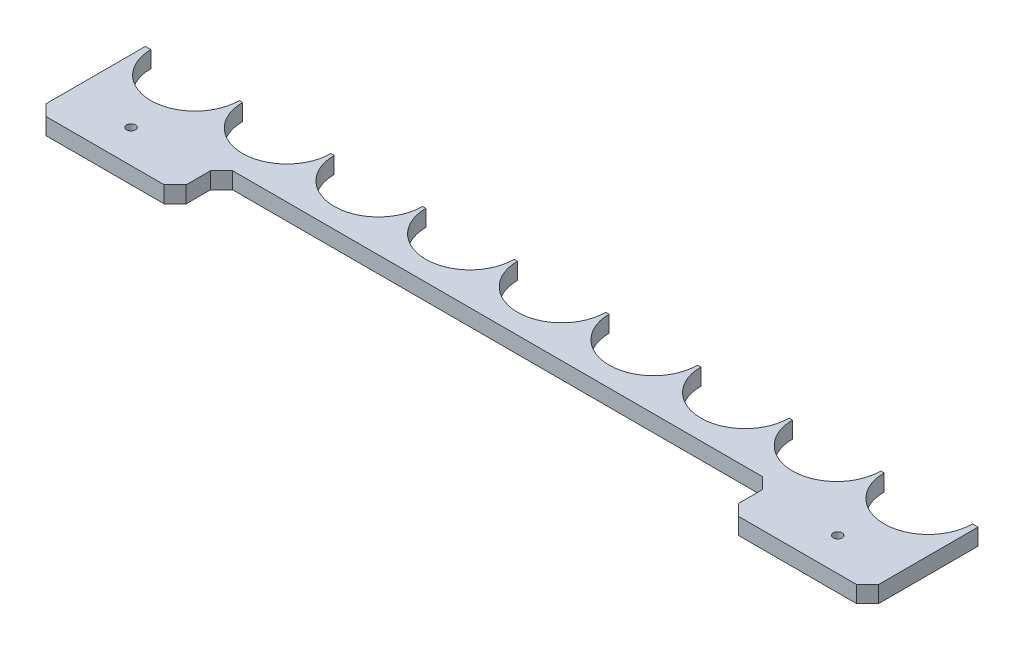
from build123d import *

# Parameters (mm, degrees)
SKETCH1_R          = 4
BASE_FLANGE1_DEPTH = 15
SKETCH6_W          = 500
SKETCH6_H          = 42
CUT_EXTRUDE1_DEPTH = 381.59689962
CHAMFER1_SIZE      = 10


# Sheet-metal steps are written as plain solids
with BuildPart() as part:
    # Sketch1 → Base-Flange1 (new body)
    with BuildSketch(Plane(origin=(0, 0, 0), x_dir=(1, 0, 0), z_dir=(0, 1, 0))):
        with BuildLine():
            Line((372, 50), (377, 50))
            Line((377, 50), (377, -50))
            Line((377, -50), (-377, -50))
            Line((-377, -50), (-377, 50))
            Line((-377, 50), (-372, 50))
            ThreePointArc((-372, 50), (-332, 10), (-292, 50))
            Line((-292, 50), (-289, 50))
            ThreePointArc((-289, 50), (-249, 10), (-209, 50))
            Line((-209, 50), (-206, 50))
            ThreePointArc((-206, 50), (-166, 10), (-126, 50))
            Line((-126, 50), (-123, 50))
            ThreePointArc((-123, 50), (-83, 10), (-43, 50))
            Line((-43, 50), (-40, 50))
            ThreePointArc((-40, 50), (0, 10), (40, 50))
            Line((40, 50), (43, 50))
            ThreePointArc((43, 50), (83, 10), (123, 50))
            Line((123, 50), (126, 50))
            ThreePointArc((126, 50), (166, 10), (206, 50))
            Line((206, 50), (209, 50))
            ThreePointArc((209, 50), (249, 10), (289, 50))
            Line((289, 50), (292, 50))
            ThreePointArc((292, 50), (332, 10), (372, 50))
        make_face()
        with Locations(Location((-320, -20, 0), (0, 0, 270))):
            Circle(SKETCH1_R, mode=Mode.SUBTRACT)
        with Locations(Location((320, -20, 0), (0, 0, 90))):
            Circle(SKETCH1_R, mode=Mode.SUBTRACT)
    extrude(amount=-BASE_FLANGE1_DEPTH)

    # Sketch6 → Cut-Extrude1 (cut, through all)
    with BuildSketch(Plane(origin=(0, 0, 0), x_dir=(1, 0, 0), z_dir=(0, 1, 0))):
        with Locations((0, -29)):
            Rectangle(SKETCH6_W, SKETCH6_H)
    extrude(amount=-CUT_EXTRUDE1_DEPTH, mode=Mode.SUBTRACT)

    # Chamfer1
    chamfer1_edges = [part.edges().sort_by_distance(p)[0] for p in [
        (377, -7.5, 50),
        (-377, -7.5, 50),
        (-250, -7.5, 50),
        (-250, -7.5, 8),
        (250, -7.5, 8),
        (250, -7.5, 50),
    ]]
    chamfer(chamfer1_edges, length=CHAMFER1_SIZE)


solid = part.part
